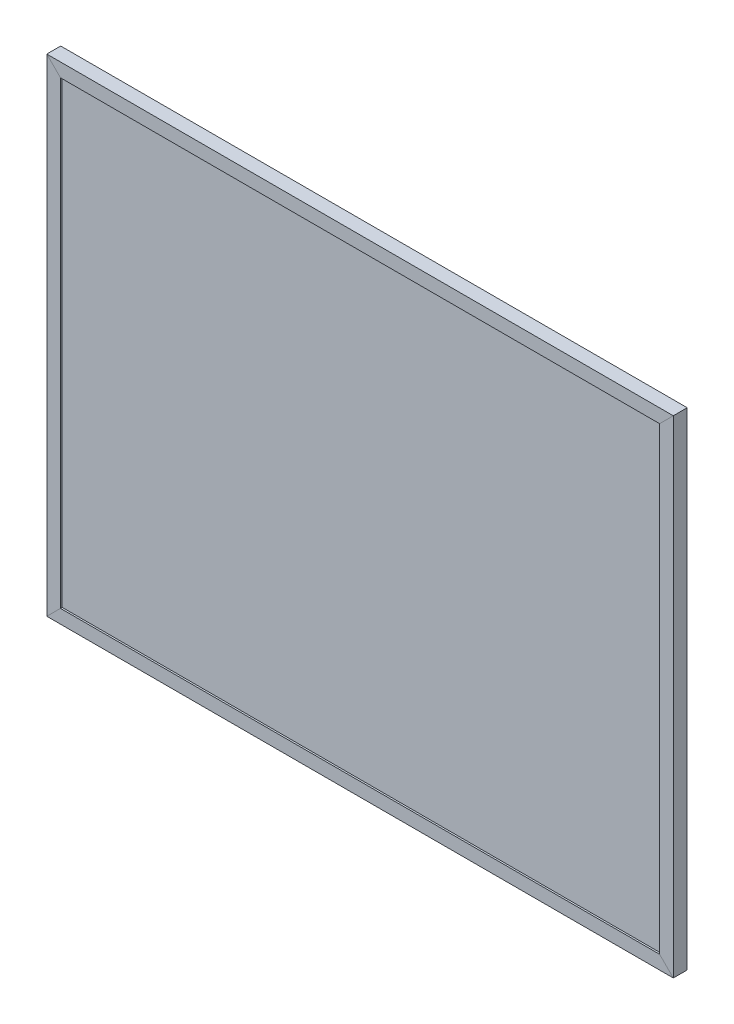
from build123d import *

# Parameters (mm, degrees)
SKETCH2_W           = 577.85
SKETCH2_H           = 447.675
BOSS_EXTRUDE1_DEPTH = 4.7625
SKETCH3_W           = 584.2
SKETCH3_H           = 454.025
SKETCH3_W_2         = 577.85
SKETCH3_H_2         = 447.675
BOSS_EXTRUDE2_DEPTH = 6.4897
SKETCH4_W           = 584.2
SKETCH4_H           = 454.025
SKETCH4_W_2         = 558.6476
SKETCH4_H_2         = 428.4726
BOSS_EXTRUDE3_DEPTH = 1.5875
SPLIT1_START        = -6.4897
SPLIT1_DEPTH        = 12.9794
SPLIT1_2_DEPTH      = 1.5875
SPLIT1_START_2      = 4.9022
SPLIT1_3_DEPTH      = 1.5875
SPLIT1_4_DEPTH      = 12.9794
SPLIT1_5_DEPTH      = 1.5875
SPLIT1_6_DEPTH      = 1.5875
SPLIT1_7_DEPTH      = 12.9794
SPLIT1_8_DEPTH      = 1.5875
SPLIT1_9_DEPTH      = 1.5875
SPLIT1_START_3      = -282.77030474
SPLIT1_10_OUTLINE_W = 322.113794703
SPLIT1_10_OUTLINE_H = 12.9794
SPLIT1_10_DEPTH     = 716.067662582
SPLIT1_START_4      = -300.838580056
SPLIT1_11_OUTLINE_W = 414.886205297
SPLIT1_11_OUTLINE_H = 12.9794
SPLIT1_11_DEPTH     = 321.044156328


# Read off the part's stored shape, not the designer's step: Split1
with BuildPart() as part:
    # Sketch2 → Boss-Extrude1 (new, symmetric)
    with BuildSketch(Plane.XY):
        with Locations((292.1, 198.4375)):
            Rectangle(SKETCH2_W, SKETCH2_H)
    extrude(amount=BOSS_EXTRUDE1_DEPTH, both=True)


with BuildPart() as body_2:
    # Sketch3 → Boss-Extrude2 (new, symmetric)
    with BuildSketch(Plane.XY):
        with Locations((292.1, 198.4375)):
            Rectangle(SKETCH3_W, SKETCH3_H)
        with Locations((292.1, 198.4375)):
            Rectangle(SKETCH3_W_2, SKETCH3_H_2, mode=Mode.SUBTRACT)
    extrude(amount=BOSS_EXTRUDE2_DEPTH, both=True)

    # Sketch4 → Boss-Extrude3 (add)
    with BuildSketch(Plane.XY.offset(6.4897)):
        with Locations((292.1, 198.4375)):
            Rectangle(SKETCH4_W, SKETCH4_H)
        with Locations((292.1, 198.4375)):
            Rectangle(SKETCH4_W_2, SKETCH4_H_2, mode=Mode.SUBTRACT)
    boss_extrude3 = extrude(amount=-BOSS_EXTRUDE3_DEPTH)

    # Mirror1: Boss-Extrude3 across plane
    add(boss_extrude3.mirror(Plane.XY))

    # Split1 10 outline → Split1 10 (cut)
    with BuildSketch(Plane(origin=(0, 0, 0), x_dir=(0.707106781186548, 0.707106781186547, 0), z_dir=(0.707106781186547, -0.707106781186548, 0)).offset(SPLIT1_START_3)):
        with Locations((553.943102649, 0)):
            Rectangle(SPLIT1_10_OUTLINE_W, SPLIT1_10_OUTLINE_H)
    extrude(amount=SPLIT1_10_DEPTH, mode=Mode.SUBTRACT)

    # Split1 11 outline → Split1 11 (cut)
    with BuildSketch(Plane(origin=(0, 0, 0), x_dir=(0.707106781186548, 0.707106781186547, 0), z_dir=(0.707106781186547, -0.707106781186548, 0)).offset(SPLIT1_START_4)):
        with Locations((185.443102649, 0)):
            Rectangle(SPLIT1_11_OUTLINE_W, SPLIT1_11_OUTLINE_H)
    extrude(amount=SPLIT1_11_DEPTH, mode=Mode.SUBTRACT)


with BuildPart() as body_3:
    # Split1 outline → Split1 (new body)
    with BuildSketch(Plane.XY.offset(SPLIT1_START)):
        Polygon((581.025, -25.4), (584.2, -28.575), (584.2, 425.45), (581.025, 422.275), align=None)
    extrude(amount=SPLIT1_DEPTH)

    # Split1 2 outline → Split1 2 (add)
    with BuildSketch(Plane.XY.offset(SPLIT1_START)):
        Polygon((571.4238, -15.7988), (581.025, -25.4), (581.025, 422.275), (571.4238, 412.6738), align=None)
    extrude(amount=SPLIT1_2_DEPTH)

    # Split1 3 outline → Split1 3 (add)
    with BuildSketch(Plane.XY.offset(SPLIT1_START_2)):
        Polygon((571.4238, -15.7988), (581.025, -25.4), (581.025, 422.275), (571.4238, 412.6738), align=None)
    extrude(amount=SPLIT1_3_DEPTH)


with BuildPart() as body_4:
    # Split1 4 outline → Split1 4 (new body)
    with BuildSketch(Plane.XY.offset(SPLIT1_START)):
        Polygon((581.025, 422.275), (584.2, 425.45), (0, 425.45), (3.175, 422.275), align=None)
    extrude(amount=SPLIT1_4_DEPTH)

    # Split1 5 outline → Split1 5 (add)
    with BuildSketch(Plane.XY.offset(SPLIT1_START)):
        Polygon((571.4238, 412.6738), (581.025, 422.275), (3.175, 422.275), (12.7762, 412.6738), align=None)
    extrude(amount=SPLIT1_5_DEPTH)

    # Split1 6 outline → Split1 6 (add)
    with BuildSketch(Plane.XY.offset(SPLIT1_START_2)):
        Polygon((571.4238, 412.6738), (581.025, 422.275), (3.175, 422.275), (12.7762, 412.6738), align=None)
    extrude(amount=SPLIT1_6_DEPTH)


with BuildPart() as body_5:
    # Split1 7 outline → Split1 7 (new body)
    with BuildSketch(Plane.XY.offset(SPLIT1_START)):
        Polygon((3.175, 422.275), (0, 425.45), (0, -28.575), (3.175, -25.4), align=None)
    extrude(amount=SPLIT1_7_DEPTH)

    # Split1 8 outline → Split1 8 (add)
    with BuildSketch(Plane.XY.offset(SPLIT1_START)):
        Polygon((12.7762, 412.6738), (3.175, 422.275), (3.175, -25.4), (12.7762, -15.7988), align=None)
    extrude(amount=SPLIT1_8_DEPTH)

    # Split1 9 outline → Split1 9 (add)
    with BuildSketch(Plane.XY.offset(SPLIT1_START_2)):
        Polygon((12.7762, 412.6738), (3.175, 422.275), (3.175, -25.4), (12.7762, -15.7988), align=None)
    extrude(amount=SPLIT1_9_DEPTH)


solid = Compound([part.part, body_2.part, body_3.part, body_4.part, body_5.part])
